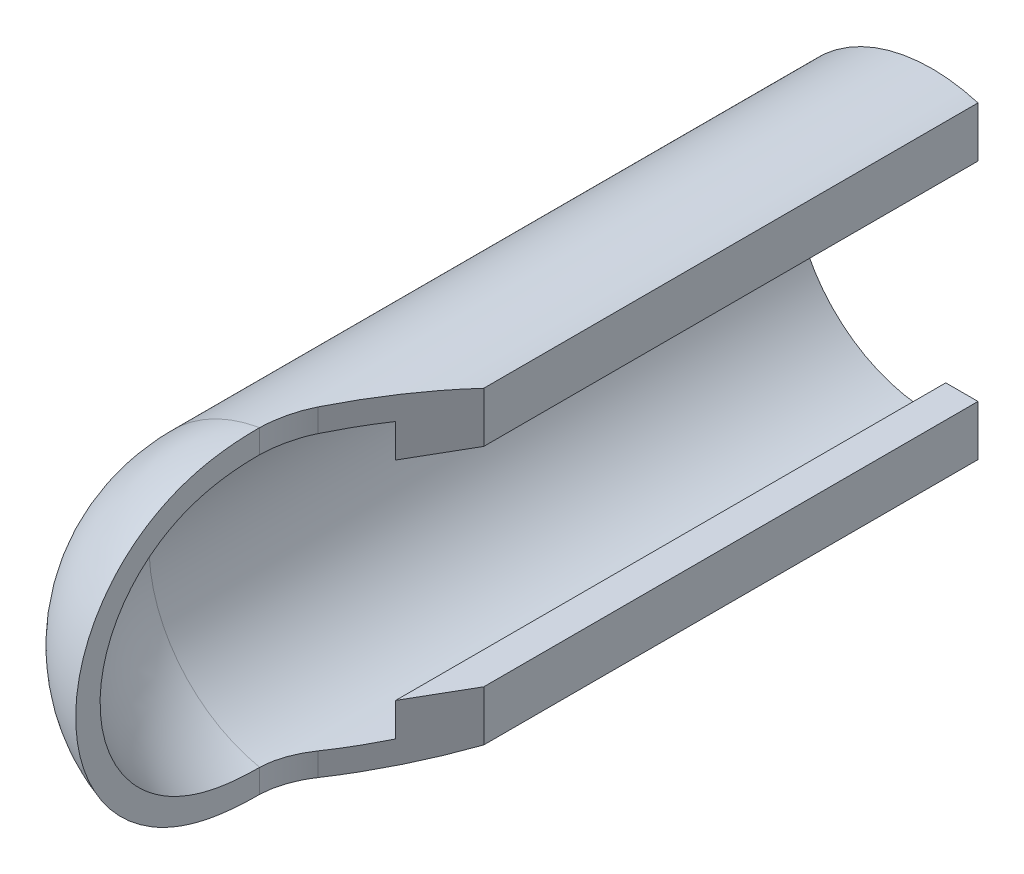
from build123d import *

# Parameters (mm, degrees)
BOSS_EXTRUDE1_DEPTH = 140
CUT_EXTRUDE1_DEPTH  = 161.390149323
REVOLVE1_ANGLE      = 90
CUT_EXTRUDE2_DEPTH  = 149.492424191


with BuildPart() as part:
    # Sketch1 → Boss-Extrude1 (new body)
    with BuildSketch(Plane.XY):
        with BuildLine():
            Line((10, 33.541019662), (10, 22.6))
            Line((10, 22.6), (3, 22.6))
            Line((3, 22.6), (3, 29.849623113))
            ThreePointArc((3, 29.849623113), (-30, 0), (3, -29.849623113))
            Line((3, -29.849623113), (3, -22.6))
            Line((3, -22.6), (10, -22.6))
            Line((10, -22.6), (10, -33.541019662))
            ThreePointArc((10, -33.541019662), (-35, 0), (10, 33.541019662))
        make_face()
    extrude(amount=-BOSS_EXTRUDE1_DEPTH)

    # Sketch2 → Cut-Extrude1 (cut, through all)
    with BuildSketch(Plane(origin=(0, 35, 0), x_dir=(1, 0, 0), z_dir=(0, 1, 0))):
        with BuildLine():
            Line((10, 32.681085708), (-3.181533479, 9.85))
            ThreePointArc((-3.181533479, 9.85), (-5.192886169, 5.098512357), (-5.984938066, 0))
            Line((-5.984938066, 0), (10, 0))
            Line((10, 0), (10, 32.681085708))
        make_face()
    extrude(amount=-CUT_EXTRUDE1_DEPTH, mode=Mode.SUBTRACT)

    # Sketch6 → Revolve1 (revolve)
    with BuildSketch(Plane.XY):
        with BuildLine():
            Line((-5.984938066, 29.396947399), (-5.984938066, 34.484496754))
            ThreePointArc((-5.984938066, 34.484496754), (-35, 0), (-5.984938066, -34.484496754))
            Line((-5.984938066, -34.484496754), (-5.984938066, -29.396947399))
            ThreePointArc((-5.984938066, -29.396947399), (-30, 0), (-5.984938066, 29.396947399))
        make_face()
    revolve(axis=Axis((7, 34.292856399, 0), (0, 1, 0)), revolution_arc=REVOLVE1_ANGLE)

    # Sketch7 → Cut-Extrude2 (cut, through all)
    with BuildSketch(Plane(origin=(0, 0, 0), x_dir=(-1, 0, 0), z_dir=(0, 0, -1))):
        Polygon((5.984938066, 34.484496754), (-7, 34.484496754), (-7, -40), (5.984938066, -35.134025746), align=None)
    extrude(amount=-CUT_EXTRUDE2_DEPTH, mode=Mode.SUBTRACT)


solid = part.part
